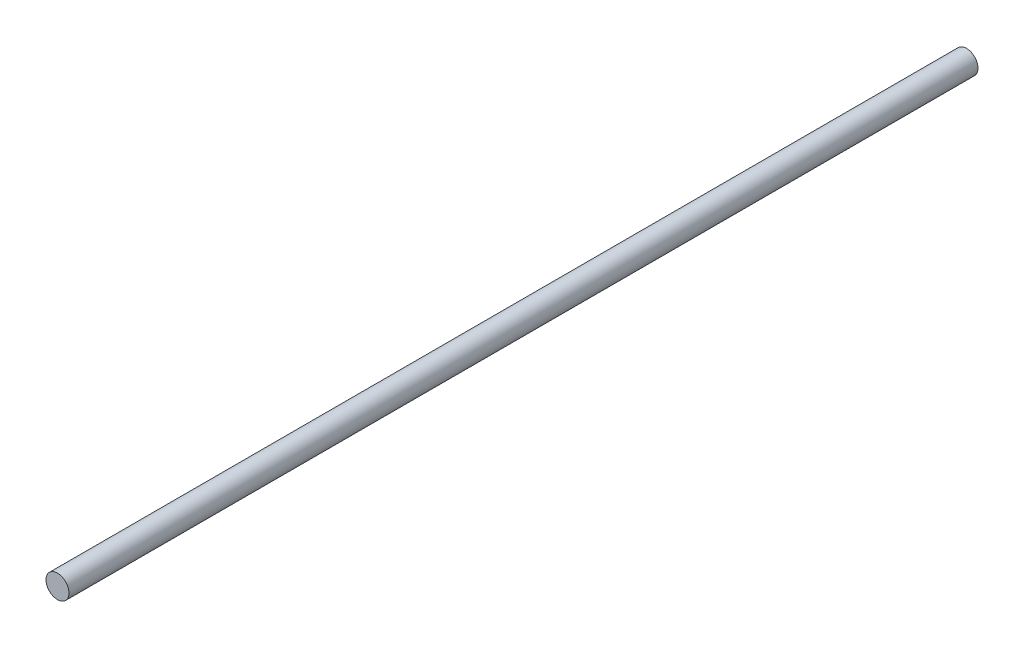
from build123d import *

# Parameters (mm, degrees)
SKETCH1_R           = 4
BOSS_EXTRUDE1_DEPTH = 316


with BuildPart() as part:
    # Sketch1 → Boss-Extrude1 (new body)
    with BuildSketch(Plane(origin=(0, 0, 0), x_dir=(0, 1, 0), z_dir=(0, 0, 1))):
        Circle(SKETCH1_R)
    extrude(amount=BOSS_EXTRUDE1_DEPTH)


solid = part.part
